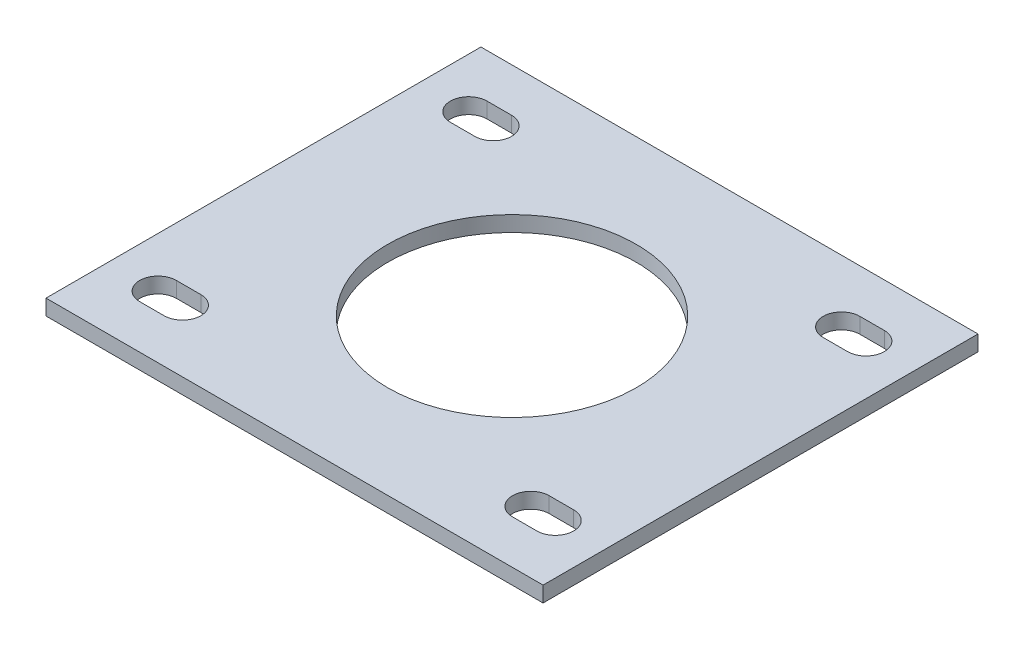
from build123d import *

# Parameters (mm, degrees)
SKETCH1_W           = 101.6
SKETCH1_H           = 88.9
SKETCH1_R           = 25.4
BOSS_EXTRUDE1_DEPTH = 3.175
CUT_EXTRUDE1_DEPTH  = 68.576054376


with BuildPart() as part:
    # Sketch1 → Boss-Extrude1 (new body)
    with BuildSketch(Plane(origin=(0, 0, 0), x_dir=(1, 0, 0), z_dir=(0, 1, 0))):
        Rectangle(SKETCH1_W, SKETCH1_H)
        Circle(SKETCH1_R, mode=Mode.SUBTRACT)
    extrude(amount=BOSS_EXTRUDE1_DEPTH)

    # Sketch2 → Cut-Extrude1 (cut, through all)
    with BuildSketch(Plane(origin=(0, 3.175, 0), x_dir=(1, 0, 0), z_dir=(0, 1, 0))):
        with BuildLine():
            Line((-40.6, 35.5), (-35.6, 35.5))
            ThreePointArc((-35.6, 35.5), (-31.85, 31.75), (-35.6, 28))
            Line((-35.6, 28), (-40.6, 28))
            ThreePointArc((-40.6, 28), (-44.35, 31.75), (-40.6, 35.5))
        make_face()
        with BuildLine():
            Line((-40.6, -28), (-35.6, -28))
            ThreePointArc((-35.6, -28), (-31.85, -31.75), (-35.6, -35.5))
            Line((-35.6, -35.5), (-40.6, -35.5))
            ThreePointArc((-40.6, -35.5), (-44.35, -31.75), (-40.6, -28))
        make_face()
        with BuildLine():
            Line((35.6, 35.5), (40.6, 35.5))
            ThreePointArc((40.6, 35.5), (44.35, 31.75), (40.6, 28))
            Line((40.6, 28), (35.6, 28))
            ThreePointArc((35.6, 28), (31.85, 31.75), (35.6, 35.5))
        make_face()
        with BuildLine():
            Line((35.6, -28), (40.6, -28))
            ThreePointArc((40.6, -28), (44.35, -31.75), (40.6, -35.5))
            Line((40.6, -35.5), (35.6, -35.5))
            ThreePointArc((35.6, -35.5), (31.85, -31.75), (35.6, -28))
        make_face()
    extrude(amount=-CUT_EXTRUDE1_DEPTH, mode=Mode.SUBTRACT)


solid = part.part
